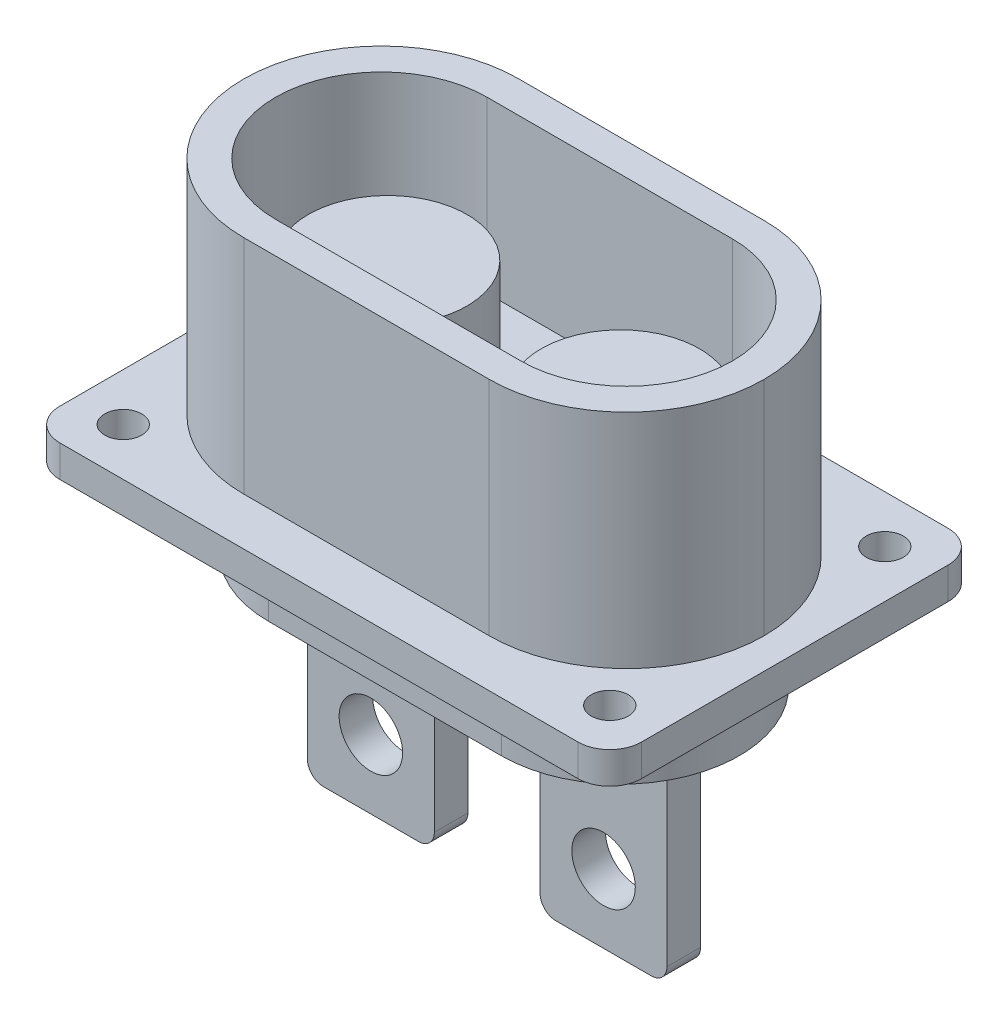
from build123d import *

# Parameters (mm, degrees)
SKETCH1_W           = 55
SKETCH1_H           = 35
SKETCH1_R           = 1.75
BOSS_EXTRUDE1_DEPTH = 3
FILLET1_R           = 3
SKETCH2_W           = 49.2
SKETCH2_H           = 26
BOSS_EXTRUDE2_DEPTH = 21
FILLET2_R           = 13
BOSS_EXTRUDE3_DEPTH = 28.6
SKETCH4_R           = 3
CUT_EXTRUDE1_DEPTH  = 45.02888434
CUT_EXTRUDE2_DEPTH  = 16.05
SKETCH6_R           = 11.25
BOSS_EXTRUDE4_DEPTH = 8
SKETCH7_R           = 7.5
BOSS_EXTRUDE5_DEPTH = 8
FILLET3_R           = 1.5


with BuildPart() as part:
    # Sketch1 → Boss-Extrude1 (new body)
    with BuildSketch(Plane(origin=(0, 0, 0), x_dir=(1, 0, 0), z_dir=(0, 1, 0))):
        Rectangle(SKETCH1_W, SKETCH1_H)
        with Locations(Location((-23, 13, 0), (0, 0, 270))):
            Circle(SKETCH1_R, mode=Mode.SUBTRACT)
        with Locations(Location((-23, -13, 0), (0, 0, 270))):
            Circle(SKETCH1_R, mode=Mode.SUBTRACT)
        with Locations(Location((23, -13, 0), (0, 0, 270))):
            Circle(SKETCH1_R, mode=Mode.SUBTRACT)
        with Locations(Location((23, 13, 0), (0, 0, 270))):
            Circle(SKETCH1_R, mode=Mode.SUBTRACT)
    extrude(amount=BOSS_EXTRUDE1_DEPTH)

    # Fillet1
    fillet1_edges = [part.edges().sort_by_distance(p)[0] for p in [
        (27.5, 1.5, 17.5),
        (-27.5, 1.5, 17.5),
        (-27.5, 1.5, -17.5),
        (27.5, 1.5, -17.5),
    ]]
    fillet(fillet1_edges, radius=FILLET1_R)

    # Sketch2 → Boss-Extrude2 (add)
    with BuildSketch(Plane(origin=(0, 3, 0), x_dir=(1, 0, 0), z_dir=(0, 1, 0))):
        Rectangle(SKETCH2_W, SKETCH2_H)
    extrude(amount=BOSS_EXTRUDE2_DEPTH)

    # Fillet2
    # the kernel refuses this fillet: 13 mm, written as the material it takes off along each edge
    with BuildSketch(Plane(origin=(-24.6, 3, 13), x_dir=(1, 0, 0), z_dir=(0, 1, 0)), Plane(origin=(24.6, 3, -13), x_dir=(-1, 0, 0), z_dir=(0, 1, 0)), Plane(origin=(24.6, 3, 13), x_dir=(0, 0, -1), z_dir=(0, 1, 0))) as fillet2_piece_1:
        with BuildLine():
            CenterArc((FILLET2_R, FILLET2_R), FILLET2_R, 180, 90)
            Line((0, FILLET2_R), (0, 0))
            Line((0, 0), (FILLET2_R, 0))
        make_face()
    extrude(amount=53.5, mode=Mode.SUBTRACT)
    with BuildSketch(Plane(origin=(-24.6, 3, -13), x_dir=(1, 0, 0), z_dir=(0, 1, 0))) as fillet2_piece_2:
        with BuildLine():
            CenterArc((FILLET2_R, -FILLET2_R), FILLET2_R, 90, 90)
            Line((0, -FILLET2_R), (0, 0))
            Line((0, 0), (FILLET2_R, 0))
        make_face()
    extrude(amount=53.5, mode=Mode.SUBTRACT)

    # Sketch3 → Boss-Extrude3 (add)
    with BuildSketch(Plane.XZ):
        Polygon((-11, 0), (-17, 0), (-17, -1.5875), (-5, -1.5875), (-5, 0), align=None)
        Polygon((-17, 1.5875), (-17, 0), (-11, 0), (-5, 0), (-5, 1.5875), align=None)
        Polygon((5, 1.5875), (5, 0), (11, 0), (17, 0), (17, 1.5875), align=None)
        Polygon((11, 0), (5, 0), (5, -1.5875), (17, -1.5875), (17, 0), align=None)
    extrude(amount=BOSS_EXTRUDE3_DEPTH)

    # Sketch4 → Cut-Extrude1 (cut, through all)
    with BuildSketch(Plane.XY.offset(1.5875)):
        with Locations((-11, -22.1)):
            Circle(SKETCH4_R)
    cut_extrude1 = extrude(amount=-CUT_EXTRUDE1_DEPTH, mode=Mode.SUBTRACT)

    # Mirror1: Cut-Extrude1 across plane
    add(cut_extrude1.mirror(Plane(origin=(0, 0, 0), x_dir=(0, 0, 1), z_dir=(1, 0, 0))), mode=Mode.SUBTRACT)

    # Sketch5 → Cut-Extrude2 (cut)
    with BuildSketch(Plane(origin=(0, 24, 0), x_dir=(1, 0, 0), z_dir=(0, 1, 0))):
        with BuildLine():
            Line((-11.6, -10), (11.6, -10))
            ThreePointArc((11.6, -10), (18.671067812, -7.071067812), (21.6, 0))
            ThreePointArc((21.6, 0), (18.671067812, 7.071067812), (11.6, 10))
            Line((11.6, 10), (-11.6, 10))
            ThreePointArc((-11.6, 10), (-18.671067812, 7.071067812), (-21.6, 0))
            ThreePointArc((-21.6, 0), (-18.671067812, -7.071067812), (-11.6, -10))
        make_face()
    extrude(amount=-CUT_EXTRUDE2_DEPTH, mode=Mode.SUBTRACT)

    # Sketch6 → Boss-Extrude4 (add)
    with BuildSketch(Plane.XZ):
        with BuildLine():
            Line((-11, 1.5875), (-11, 11.25))
            ThreePointArc((-11, 11.25), (-22.25, 0), (-11, -11.25))
            Line((-11, -11.25), (-11, -1.5875))
            Line((-11, -1.5875), (-17, -1.5875))
            Line((-17, -1.5875), (-17, 1.5875))
            Line((-17, 1.5875), (-11, 1.5875))
        make_face()
        with BuildLine():
            ThreePointArc((0, 2.358495283), (-3.927891825, 8.749159158), (-11, 11.25))
            Line((-11, 11.25), (-11, 1.5875))
            Line((-11, 1.5875), (-5, 1.5875))
            Line((-5, 1.5875), (-5, -1.5875))
            Line((-5, -1.5875), (-11, -1.5875))
            Line((-11, -1.5875), (-11, -11.25))
            ThreePointArc((-11, -11.25), (-3.927891825, -8.749159158), (0, -2.358495283))
            ThreePointArc((0, -2.358495283), (-0.25, 0), (0, 2.358495283))
        make_face()
        with BuildLine():
            Line((11, 1.5875), (11, 11.25))
            ThreePointArc((11, 11.25), (3.927891825, 8.749159158), (0, 2.358495283))
            ThreePointArc((0, 2.358495283), (0.187325418, 1.185854123), (0.25, 0))
            ThreePointArc((0.25, 0), (0.187325418, -1.185854123), (0, -2.358495283))
            ThreePointArc((0, -2.358495283), (3.927891825, -8.749159158), (11, -11.25))
            Line((11, -11.25), (11, -1.5875))
            Line((11, -1.5875), (5, -1.5875))
            Line((5, -1.5875), (5, 1.5875))
            Line((5, 1.5875), (11, 1.5875))
        make_face()
        with BuildLine():
            ThreePointArc((22.25, 0), (18.954951288, 7.954951288), (11, 11.25))
            Line((11, 11.25), (11, 1.5875))
            Line((11, 1.5875), (17, 1.5875))
            Line((17, 1.5875), (17, -1.5875))
            Line((17, -1.5875), (11, -1.5875))
            Line((11, -1.5875), (11, -11.25))
            ThreePointArc((11, -11.25), (18.954951288, -7.954951288), (22.25, 0))
        make_face()
        with BuildLine():
            ThreePointArc((0, 2.358495283), (3.927891825, 8.749159158), (11, 11.25))
            Line((11, 11.25), (-11, 11.25))
            ThreePointArc((-11, 11.25), (-3.927891825, 8.749159158), (0, 2.358495283))
        make_face()
        with BuildLine():
            ThreePointArc((0, -2.358495283), (-3.927891825, -8.749159158), (-11, -11.25))
            Line((-11, -11.25), (11, -11.25))
            ThreePointArc((11, -11.25), (3.927891825, -8.749159158), (0, -2.358495283))
        make_face()
        with Locations((11, 0)):
            Circle(SKETCH6_R)
        with Locations((-11, 0)):
            Circle(SKETCH6_R)
    extrude(amount=BOSS_EXTRUDE4_DEPTH)

    # Sketch7 → Boss-Extrude5 (add)
    with BuildSketch(Plane(origin=(0, 7.95, 0), x_dir=(1, 0, 0), z_dir=(0, 1, 0))):
        with Locations(Location((-11, 0, 0), (0, 0, 270))):
            Circle(SKETCH7_R)
        with Locations(Location((11, 0, 0), (0, 0, 270))):
            Circle(SKETCH7_R)
    extrude(amount=BOSS_EXTRUDE5_DEPTH)

    # Fillet3
    fillet3_edges = [part.edges().sort_by_distance(p)[0] for p in [
        (-5, -28.6, 0),
        (-17, -28.6, 0),
        (17, -28.6, 0),
        (5, -28.6, 0),
    ]]
    fillet(fillet3_edges, radius=FILLET3_R)


solid = part.part
